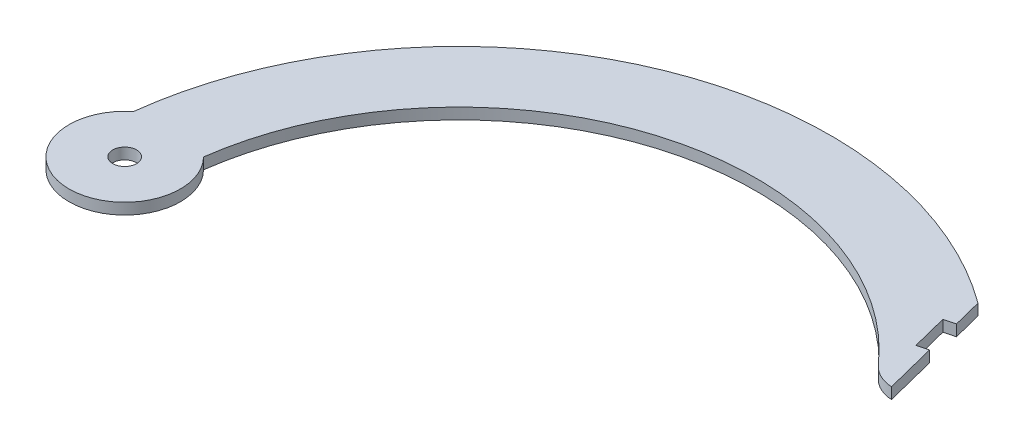
from build123d import *

# Parameters (mm, degrees)
SKETCH3_R              = 100
SKETCH3_R_2            = 80
BOSS_EXTRUDE1_DEPTH    = 3
SPLIT2_SURFACE_1_BACK  = 283.859
SPLIT2_SURFACE_1_DEPTH = 567.718
SPLIT2_SURFACE_2_BACK  = 283.859
SPLIT2_SURFACE_2_DEPTH = 567.718
BODY_DELETE1_DEPTH     = 3
SKETCH5_R              = 15
BOSS_EXTRUDE2_DEPTH    = 3
SKETCH6_R              = 3.21
CUT_EXTRUDE1_DEPTH     = 3
SPLIT3_SURFACE_3_BACK  = 209.781
SPLIT3_SURFACE_3_DEPTH = 419.562
SPLIT3_SURFACE_4_BACK  = 209.781
SPLIT3_SURFACE_4_DEPTH = 419.562
SPLIT4_SURFACE_5_BACK  = 209.781
SPLIT4_SURFACE_5_DEPTH = 419.562
SPLIT4_SURFACE_6_BACK  = 209.781
SPLIT4_SURFACE_6_DEPTH = 419.562
FILLET1_R              = 10
SPLIT5_SURFACE_7_BACK  = 207.768
SPLIT5_SURFACE_7_DEPTH = 415.536
SPLIT5_SURFACE_8_BACK  = 207.768
SPLIT5_SURFACE_8_DEPTH = 415.536


# Read off the part's stored shape, not the designer's step: Body-Delete1
with BuildPart() as part:
    # Sketch3 → Boss-Extrude1 (new body)
    with BuildSketch(Plane(origin=(0, 0, 0), x_dir=(1, 0, 0), z_dir=(0, 1, 0))):
        with Locations(Location((0, 0, 0), (0, 0, 270))):
            Circle(SKETCH3_R)
        with Locations(Location((0, 0, 0), (0, 0, 270))):
            Circle(SKETCH3_R_2, mode=Mode.SUBTRACT)
    extrude(amount=BOSS_EXTRUDE1_DEPTH)


with BuildPart() as body_2:
    # Split2: the piece behind the surface
    add(part.part)
    # Split2 surface: a surface, the sketch's curves swept straight by 567.718 mm
    with BuildLine(Plane(origin=(0, 3, 0), x_dir=(1, 0, 0), z_dir=(0, 1, 0)).offset(-SPLIT2_SURFACE_1_BACK), mode=Mode.PRIVATE) as split2_surface_1_path:
        Line((69.282032303, 72.111025509), (69.282032303, 40))
        Line((69.282032303, 40), (69.282032303, 0))
        Line((69.282032303, 0), (-114.167790304, 0))
        Line((-114.167790304, 0), (-114.167790304, -108.297460661))
        Line((-114.167790304, -108.297460661), (110.524137422, -108.297460661))
        Line((110.524137422, -108.297460661), (110.524137422, 72.111025509))
        Line((110.524137422, 72.111025509), (69.282032303, 72.111025509))
    split2_surface_1 = Shell.extrude(split2_surface_1_path.wire(), (0 * SPLIT2_SURFACE_1_DEPTH, 1 * SPLIT2_SURFACE_1_DEPTH, 0 * SPLIT2_SURFACE_1_DEPTH))
    split(bisect_by=split2_surface_1, keep=Keep.BOTTOM)

    # Sketch5 → Boss-Extrude2 (add)
    with BuildSketch(Plane(origin=(0, 3, 0), x_dir=(1, 0, 0), z_dir=(0, 1, 0))):
        with Locations((-89.945938306, 0)):
            Circle(SKETCH5_R)
    extrude(amount=-BOSS_EXTRUDE2_DEPTH)

    # Sketch6 → Cut-Extrude1 (cut)
    with BuildSketch(Plane(origin=(0, 3, 0), x_dir=(1, 0, 0), z_dir=(0, 1, 0))):
        with Locations(Location((-89.945938306, 0, 0), (0, 0, 270))):
            Circle(SKETCH6_R)
    extrude(amount=-CUT_EXTRUDE1_DEPTH, mode=Mode.SUBTRACT)


with BuildPart() as part_1:
    add(part.part)

    # Split2: split by a surface, the side it looks to stays
    # Split2 surface: a surface, the sketch's curves swept straight by 567.718 mm
    with BuildLine(Plane(origin=(0, 3, 0), x_dir=(1, 0, 0), z_dir=(0, 1, 0)).offset(-SPLIT2_SURFACE_2_BACK), mode=Mode.PRIVATE) as split2_surface_2_path:
        Line((69.282032303, 72.111025509), (69.282032303, 40))
        Line((69.282032303, 40), (69.282032303, 0))
        Line((69.282032303, 0), (-114.167790304, 0))
        Line((-114.167790304, 0), (-114.167790304, -108.297460661))
        Line((-114.167790304, -108.297460661), (110.524137422, -108.297460661))
        Line((110.524137422, -108.297460661), (110.524137422, 72.111025509))
        Line((110.524137422, 72.111025509), (69.282032303, 72.111025509))
    split2_surface_2 = Shell.extrude(split2_surface_2_path.wire(), (0 * SPLIT2_SURFACE_2_DEPTH, 1 * SPLIT2_SURFACE_2_DEPTH, 0 * SPLIT2_SURFACE_2_DEPTH))
    split(bisect_by=split2_surface_2, keep=Keep.TOP)

    # Body-Delete1 outline → Body-Delete1 (cut)
    with BuildSketch(Plane(origin=(0, 0, 0), x_dir=(1, 0, 0), z_dir=(0, 1, 0))):
        with BuildLine():
            ThreePointArc((-100, 0), (39.190539482, -92.000552255), (69.282032303, 72.111025509))
            Line((69.282032303, 72.111025509), (69.282032303, 40))
            ThreePointArc((69.282032303, 40), (20.705523608, -77.274066103), (-80, 0))
            Line((-80, 0), (-100, 0))
        make_face()
    extrude(amount=BODY_DELETE1_DEPTH, mode=Mode.SUBTRACT)


with BuildPart() as body_2_2:
    # Split3: the piece behind the surface
    add(body_2.part)
    # Split3 surface: a surface, the sketch's curves swept straight by 419.562 mm
    with BuildLine(Plane(origin=(0, 3, 0), x_dir=(1, 0, 0), z_dir=(0, 1, 0)).offset(-SPLIT3_SURFACE_3_BACK), mode=Mode.PRIVATE) as split3_surface_3_path:
        Line((69.282032303, 40), (59.018656665, 80.726688062))
        Line((59.018656665, 80.726688062), (73.479070656, 80.726688062))
        Line((73.479070656, 80.726688062), (69.282032303, 40))
    split3_surface_3 = Shell.extrude(split3_surface_3_path.wire(), (0 * SPLIT3_SURFACE_3_DEPTH, 1 * SPLIT3_SURFACE_3_DEPTH, 0 * SPLIT3_SURFACE_3_DEPTH))
    split(bisect_by=split3_surface_3, keep=Keep.BOTTOM)


with BuildPart() as body_2_1:
    add(body_2.part)

    # Split3: split by a surface, the side it looks to stays
    # Split3 surface: a surface, the sketch's curves swept straight by 419.562 mm
    with BuildLine(Plane(origin=(0, 3, 0), x_dir=(1, 0, 0), z_dir=(0, 1, 0)).offset(-SPLIT3_SURFACE_4_BACK), mode=Mode.PRIVATE) as split3_surface_4_path:
        Line((69.282032303, 40), (59.018656665, 80.726688062))
        Line((59.018656665, 80.726688062), (73.479070656, 80.726688062))
        Line((73.479070656, 80.726688062), (69.282032303, 40))
    split3_surface_4 = Shell.extrude(split3_surface_4_path.wire(), (0 * SPLIT3_SURFACE_4_DEPTH, 1 * SPLIT3_SURFACE_4_DEPTH, 0 * SPLIT3_SURFACE_4_DEPTH))
    split(bisect_by=split3_surface_4, keep=Keep.TOP)


with BuildPart() as body_2_3:
    # Split4: the piece behind the surface
    add(body_2_1.part)
    # Split4 surface: a surface, the sketch's curves swept straight by 419.562 mm
    with BuildLine(Plane(origin=(0, 3, 0), x_dir=(1, 0, 0), z_dir=(0, 1, 0)).offset(-SPLIT4_SURFACE_5_BACK), mode=Mode.PRIVATE) as split4_surface_5_path:
        Line((66.865251706, 49.590165356), (62.98651951, 48.612701009))
        Line((62.98651951, 48.612701009), (66.652010809, 34.067455273))
        Line((66.652010809, 34.067455273), (71.500426054, 35.289285706))
        Line((71.500426054, 35.289285706), (67.834934755, 49.834531442))
        Line((67.834934755, 49.834531442), (66.865251706, 49.590165356))
    split4_surface_5 = Shell.extrude(split4_surface_5_path.wire(), (0 * SPLIT4_SURFACE_5_DEPTH, 1 * SPLIT4_SURFACE_5_DEPTH, 0 * SPLIT4_SURFACE_5_DEPTH))
    split(bisect_by=split4_surface_5, keep=Keep.BOTTOM)

    # Fillet1
    # the kernel refuses this fillet: 10 mm, written as the material it takes off along each edge
    with BuildSketch(Plane(origin=(63.446918188, 16.684080126, -48.728724305), x_dir=(-0.6358841650465459, 0, -0.7717845092012777), z_dir=(0, -1, 0))) as fillet1_piece_1:
        with BuildLine():
            CenterArc((5.815734054, 9.994146598), FILLET1_R, 222.907386502, 45.132130872)
            Line((-1.508817296, 3.185993579), (-1.655308323, 3.049830519))
            ThreePointArc((-1.655308323, 3.049830519), (-0.935163624, 1.507395163), (-0.180754976, -0.085601627))
            Line((-0.180754976, -0.085601627), (0.00684204, -0.199882932))
            ThreePointArc((0.00684204, -0.199882932), (2.736816025, -0.153172783), (5.46679001, -0.199882932))
            Line((5.46679001, -0.199882932), (5.47363205, 0))
        make_face()
    extrude(amount=30.368160252, mode=Mode.SUBTRACT)


with BuildPart() as body_2_4:
    add(body_2_1.part)

    # Split4: split by a surface, the side it looks to stays
    # Split4 surface: a surface, the sketch's curves swept straight by 419.562 mm
    with BuildLine(Plane(origin=(0, 3, 0), x_dir=(1, 0, 0), z_dir=(0, 1, 0)).offset(-SPLIT4_SURFACE_6_BACK), mode=Mode.PRIVATE) as split4_surface_6_path:
        Line((66.865251706, 49.590165356), (62.98651951, 48.612701009))
        Line((62.98651951, 48.612701009), (66.652010809, 34.067455273))
        Line((66.652010809, 34.067455273), (71.500426054, 35.289285706))
        Line((71.500426054, 35.289285706), (67.834934755, 49.834531442))
        Line((67.834934755, 49.834531442), (66.865251706, 49.590165356))
    split4_surface_6 = Shell.extrude(split4_surface_6_path.wire(), (0 * SPLIT4_SURFACE_6_DEPTH, 1 * SPLIT4_SURFACE_6_DEPTH, 0 * SPLIT4_SURFACE_6_DEPTH))
    split(bisect_by=split4_surface_6, keep=Keep.TOP)


with BuildPart() as body_2_4_1:
    # Split5: the piece behind the surface
    add(body_2_3.part)
    # Split5 surface: a surface, the sketch's curves swept straight by 415.536 mm
    with BuildLine(Plane(origin=(0, 3, 0), x_dir=(1, 0, 0), z_dir=(0, 1, 0)).offset(-SPLIT5_SURFACE_7_BACK), mode=Mode.PRIVATE) as split5_surface_7_path:
        Line((60.973585358, 72.969223669), (58.06453621, 72.23612541))
        Line((58.06453621, 72.23612541), (60.508197077, 62.539294919))
        Line((60.508197077, 62.539294919), (68.981543377, 64.674630251))
        Line((68.981543377, 64.674630251), (66.537882511, 74.371460742))
        Line((66.537882511, 74.371460742), (60.973585358, 72.969223669))
    split5_surface_7 = Shell.extrude(split5_surface_7_path.wire(), (0 * SPLIT5_SURFACE_7_DEPTH, 1 * SPLIT5_SURFACE_7_DEPTH, 0 * SPLIT5_SURFACE_7_DEPTH))
    split(bisect_by=split5_surface_7, keep=Keep.BOTTOM)


with BuildPart() as body_2_3_1:
    add(body_2_3.part)

    # Split5: split by a surface, the side it looks to stays
    # Split5 surface: a surface, the sketch's curves swept straight by 415.536 mm
    with BuildLine(Plane(origin=(0, 3, 0), x_dir=(1, 0, 0), z_dir=(0, 1, 0)).offset(-SPLIT5_SURFACE_8_BACK), mode=Mode.PRIVATE) as split5_surface_8_path:
        Line((60.973585358, 72.969223669), (58.06453621, 72.23612541))
        Line((58.06453621, 72.23612541), (60.508197077, 62.539294919))
        Line((60.508197077, 62.539294919), (68.981543377, 64.674630251))
        Line((68.981543377, 64.674630251), (66.537882511, 74.371460742))
        Line((66.537882511, 74.371460742), (60.973585358, 72.969223669))
    split5_surface_8 = Shell.extrude(split5_surface_8_path.wire(), (0 * SPLIT5_SURFACE_8_DEPTH, 1 * SPLIT5_SURFACE_8_DEPTH, 0 * SPLIT5_SURFACE_8_DEPTH))
    split(bisect_by=split5_surface_8, keep=Keep.TOP)


solid = body_2_4_1.part
